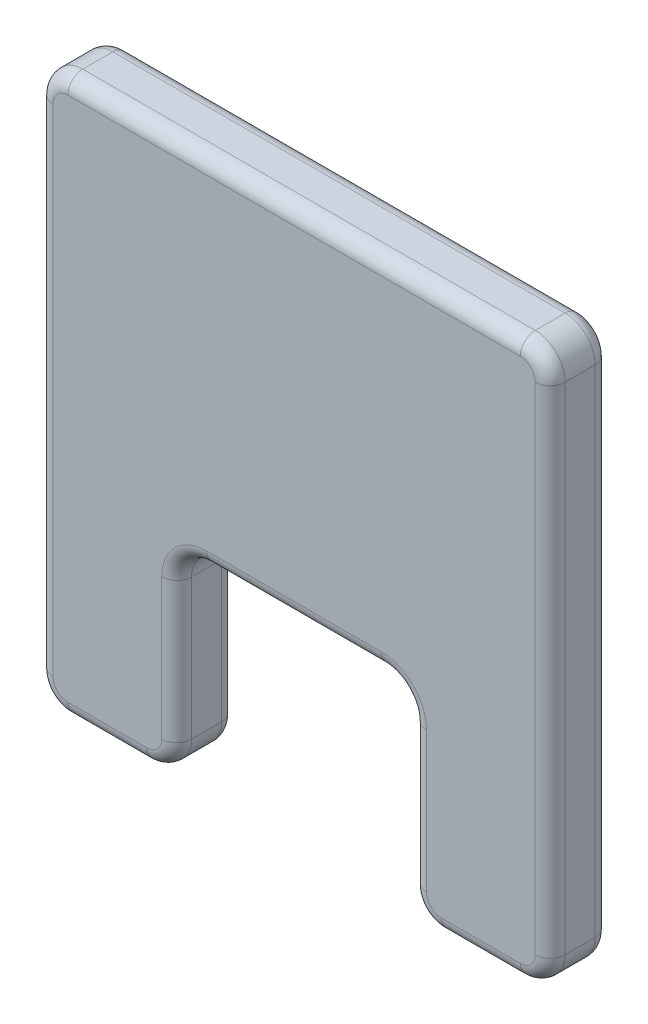
from build123d import *

# Parameters (mm, degrees)
BOSS_EXTRUDE1_DEPTH = 50.8
FILLET1_R           = 25.4
FILLET2_R           = 12.7


with BuildPart() as part:
    # Sketch1 → Boss-Extrude1 (new body)
    with BuildSketch(Plane.XY):
        Polygon((-93.295534025, 241.224648834), (341.304465963, 241.224648834), (341.304465963, -230.262851166), (223.626687979, -230.262851166), (223.626687979, -60.262851166), (24.382243959, -60.262851166), (24.382243959, -230.262851166), (-93.295534025, -230.262851166), align=None)
    extrude(amount=BOSS_EXTRUDE1_DEPTH)

    # Fillet1
    fillet1_edges = [part.edges().sort_by_distance(p)[0] for p in [
        (24.382243959, -230.262851166, 25.4),
        (-93.295534025, -230.262851166, 25.4),
        (-93.295534025, 241.224648834, 25.4),
        (341.304465963, 241.224648834, 25.4),
        (341.304465963, -230.262851166, 25.4),
        (223.626687979, -230.262851166, 25.4),
        (223.626687979, -60.262851166, 25.4),
        (24.382243959, -60.262851166, 25.4),
    ]]
    fillet(fillet1_edges, radius=FILLET1_R)

    # Fillet2
    fillet2_edges = [part.edges().sort_by_distance(p)[0] for p in [
        (31.821731717, -67.702338924, 0),
        (124.004465969, -60.262851166, 0),
        (216.187200221, -67.702338924, 0),
        (223.626687979, -145.262851166, 0),
        (231.066175737, -222.823363409, 0),
        (282.465576971, -230.262851166, 0),
        (333.864978205, -222.823363409, 0),
        (341.304465963, 5.480898834, 0),
        (333.864978205, 233.785161076, 0),
        (124.004465969, 241.224648834, 0),
        (-85.856046267, 233.785161076, 0),
        (-93.295534025, 5.480898834, 0),
        (-85.856046267, -222.823363409, 0),
        (-34.456645033, -230.262851166, 0),
        (16.942756201, -222.823363409, 0),
        (24.382243959, -145.262851166, 0),
        (-85.856046267, -222.823363409, 50.8),
        (-93.295534025, 5.480898834, 50.8),
        (-85.856046267, 233.785161076, 50.8),
        (124.004465969, 241.224648834, 50.8),
        (333.864978205, 233.785161076, 50.8),
        (341.304465963, 5.480898834, 50.8),
        (333.864978205, -222.823363409, 50.8),
        (282.465576971, -230.262851166, 50.8),
        (231.066175737, -222.823363409, 50.8),
        (223.626687979, -145.262851166, 50.8),
        (216.187200221, -67.702338924, 50.8),
        (124.004465969, -60.262851166, 50.8),
        (31.821731717, -67.702338924, 50.8),
        (24.382243959, -145.262851166, 50.8),
        (16.942756201, -222.823363409, 50.8),
        (-34.456645033, -230.262851166, 50.8),
    ]]
    fillet(fillet2_edges, radius=FILLET2_R)


solid = part.part
